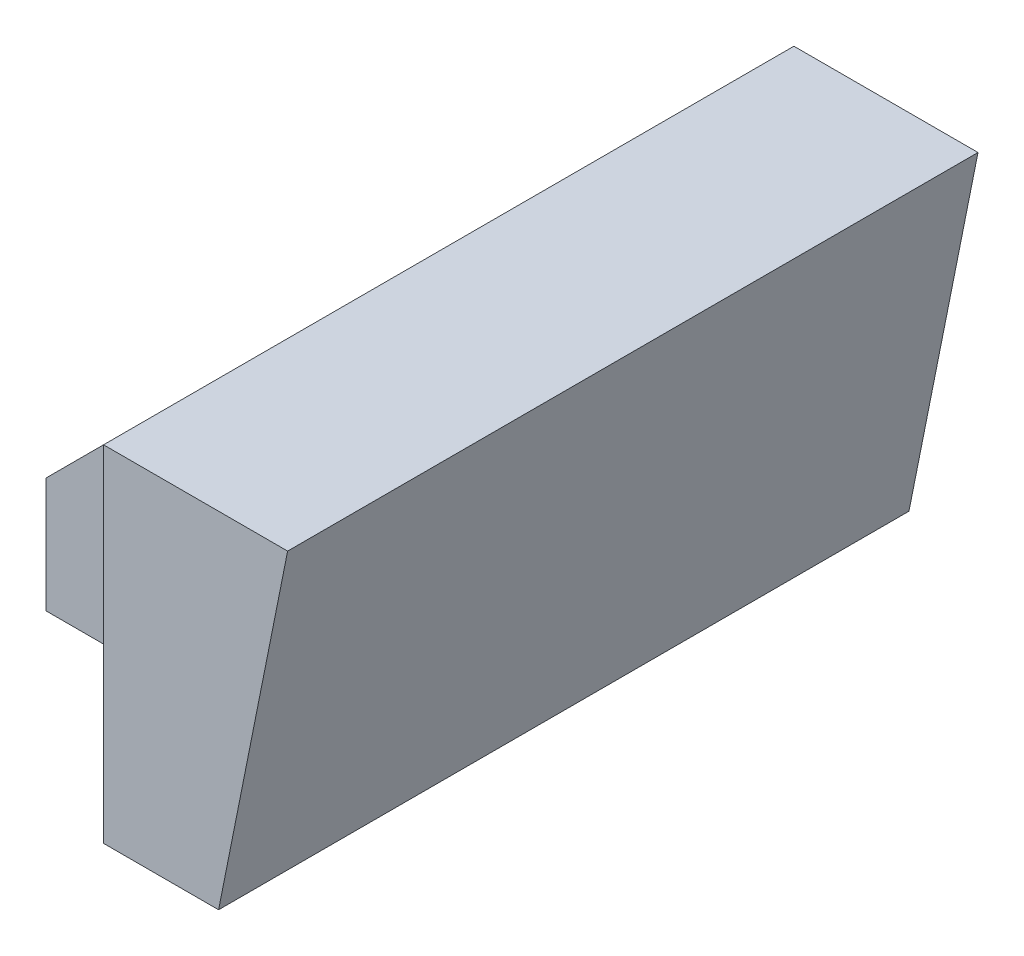
from build123d import *
from build123d.topology import SkipClean

# Parameters (mm, degrees)
CROQUIS1_W              = 8
CROQUIS1_H              = 30
SALIENTE_EXTRUIR1_DEPTH = 15
CORTAR_EXTRUIR1_DEPTH   = 34.778691508
SALIENTE_EXTRUIR2_DEPTH = 7.5
CROQUIS4_W              = 10
CROQUIS4_H              = 9
CORTAR_EXTRUIR2_DEPTH   = 10
CROQUIS5_R              = 1.6
CORTAR_EXTRUIR3_DEPTH   = 23.825424421
SALIENTE_EXTRUIR3_DEPTH = 3.5
REDONDEO1_R             = 1


with BuildPart() as part:
    # Croquis1 → Saliente-Extruir1 (new body)
    with BuildSketch(Plane(origin=(0, 0, 0), x_dir=(1, 0, 0), z_dir=(0, 1, 0))):
        Rectangle(CROQUIS1_W, CROQUIS1_H)
    extrude(amount=SALIENTE_EXTRUIR1_DEPTH)

    # Croquis2 → Cortar-Extruir1 (cut, through all)
    with BuildSketch(Plane.XY.offset(15)):
        Polygon((4, 15), (1, 0), (4, 0), align=None)
    extrude(amount=-CORTAR_EXTRUIR1_DEPTH, mode=Mode.SUBTRACT)

    # Croquis3 → Saliente-Extruir2 (add, symmetric)
    with BuildSketch(Plane.XY):
        Polygon((-14, 0), (-4, 0), (-4, 15), (-14, 5), align=None)
    extrude(amount=SALIENTE_EXTRUIR2_DEPTH, both=True)

    # Croquis4 → Cortar-Extruir2 (cut)
    with BuildSketch(Plane(origin=(0, 15, 0), x_dir=(1, 0, 0), z_dir=(0, 1, 0))):
        with Locations((-9, 0)):
            Rectangle(CROQUIS4_W, CROQUIS4_H)
    extrude(amount=-CORTAR_EXTRUIR2_DEPTH, mode=Mode.SUBTRACT)

    # Croquis5 → Cortar-Extruir3 (cut, through all)
    with BuildSketch(Plane(origin=(0, 5, 0), x_dir=(1, 0, 0), z_dir=(0, 1, 0))):
        with Locations(Location((-9, 0, 0), (0, 0, 270))):
            Circle(CROQUIS5_R)
    extrude(amount=-CORTAR_EXTRUIR3_DEPTH, mode=Mode.SUBTRACT)

    # Croquis6 → Saliente-Extruir3 (add)
    with SkipClean():  # the faces are left unmerged after this step: merging them gives an invalid solid
        with BuildSketch(Plane.XZ):
            with BuildLine():
                Line((-8.443223564, 1.5), (-4, 1.5))
                Line((-4, 1.5), (-4, -1.5))
                Line((-4, -1.5), (-8.443223564, -1.5))
                ThreePointArc((-8.443223564, -1.5), (-7.4, 0), (-8.443223564, 1.5))
            make_face()
            with BuildLine():
                Line((-14, -1.5), (-9.556776436, -1.5))
                ThreePointArc((-9.556776436, -1.5), (-10.6, 0), (-9.556776436, 1.5))
                Line((-9.556776436, 1.5), (-14, 1.5))
                Line((-14, 1.5), (-14, -1.5))
            make_face()
        extrude(amount=SALIENTE_EXTRUIR3_DEPTH)

    # Redondeo1
    # the kernel refuses this fillet: 1 mm, written as the material it takes off along each edge
    with BuildSketch(Plane(origin=(-8.443223564, 0, 1.5), x_dir=(1, 0, 0), z_dir=(0, -1, 0)), Plane(origin=(-9.556776436, 0, -1.5), x_dir=(-1, 0, 0), z_dir=(0, -1, 0))) as redondeo1_piece_1:
        with BuildLine():
            CenterArc((1.994693728, -1), REDONDEO1_R, 90, 101.087489211)
            ThreePointArc((1.01335905, -1.192307692), (0.662378184, -0.463823369), (0, 0))
            Line((0, 0), (1.994693728, 0))
        make_face()
    extrude(amount=8.48673432, mode=Mode.SUBTRACT)
    with BuildSketch(Plane(origin=(-8.443223564, 0, -1.5), x_dir=(1, 0, 0), z_dir=(0, -1, 0)), Plane(origin=(-9.556776436, 0, 1.5), x_dir=(-1, 0, 0), z_dir=(0, -1, 0))) as redondeo1_piece_2:
        with BuildLine():
            CenterArc((1.994693728, 1), REDONDEO1_R, 168.912510789, 101.087489211)
            ThreePointArc((1.01335905, 1.192307692), (0.662378184, 0.463823369), (0, 0))
            Line((0, 0), (1.994693728, 0))
        make_face()
    extrude(amount=8.48673432, mode=Mode.SUBTRACT)


solid = part.part
